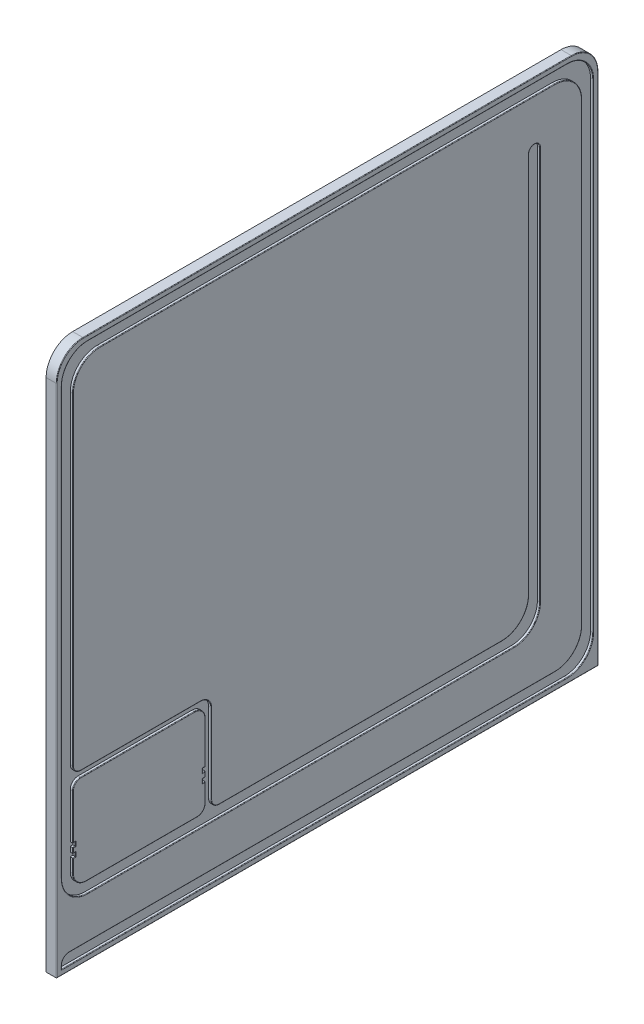
from build123d import *

# Parameters (mm, degrees)
BOSS_EXTRUDE1_DEPTH = 4
CUT_EXTRUDE3_DEPTH  = 1
FILLET1_R           = 0.2


with BuildPart() as part:
    # Sketch1 → Boss-Extrude1 (new body)
    with BuildSketch(Plane(origin=(0, 0, 0), x_dir=(0, 0, -1), z_dir=(1, 0, 0))):
        with BuildLine():
            Line((-102, -102), (102, -102))
            Line((102, -102), (102, 92))
            ThreePointArc((102, 92), (99.071067812, 99.071067812), (92, 102))
            Line((92, 102), (-92, 102))
            ThreePointArc((-92, 102), (-99.071067812, 99.071067812), (-102, 92))
            Line((-102, 92), (-102, -102))
        make_face()
    extrude(amount=BOSS_EXTRUDE1_DEPTH)

    # Sketch2 → Cut-Extrude3 (cut)
    with BuildSketch(Plane(origin=(4, 0, 0), x_dir=(0, 0, -1), z_dir=(1, 0, 0))):
        with BuildLine():
            Line((-100.1, 90.3), (-100.1, -70.3))
            ThreePointArc((-100.1, -70.3), (-97.229646456, -77.229646456), (-90.3, -80.1))
            Line((-90.3, -80.1), (70.3, -80.1))
            ThreePointArc((70.3, -80.1), (77.229646456, -77.229646456), (80.1, -70.3))
            Line((80.1, -70.3), (80.1, 78))
            ThreePointArc((80.1, 78), (78, 80.1), (75.9, 78))
            Line((75.9, 78), (75.9, -65.7))
            ThreePointArc((75.9, -65.7), (72.912489168, -72.912489168), (65.7, -75.9))
            Line((65.7, -75.9), (-40.8, -75.9))
            ThreePointArc((-40.8, -75.9), (-42.921320344, -75.021320344), (-43.8, -72.9))
            Line((-43.8, -72.9), (-43.8, -42.8))
            ThreePointArc((-43.8, -42.8), (-44.971572875, -39.971572875), (-47.8, -38.8))
            Line((-47.8, -38.8), (-92.9, -38.8))
            ThreePointArc((-92.9, -38.8), (-95.021320344, -37.921320344), (-95.9, -35.8))
            Line((-95.9, -35.8), (-95.9, 85.7))
            ThreePointArc((-95.9, 85.7), (-92.912489168, 92.912489168), (-85.7, 95.9))
            Line((-85.7, 95.9), (85.7, 95.9))
            ThreePointArc((85.7, 95.9), (92.912489168, 92.912489168), (95.9, 85.7))
            Line((95.9, 85.7), (95.9, -85.7))
            ThreePointArc((95.9, -85.7), (92.912489168, -92.912489168), (85.7, -95.9))
            Line((85.7, -95.9), (-97.3, -95.9))
            ThreePointArc((-97.3, -95.9), (-99.279898987, -96.720101013), (-100.1, -98.7))
            Line((-100.1, -98.7), (-100.1, -100.1))
            Line((-100.1, -100.1), (90.3, -100.1))
            ThreePointArc((90.3, -100.1), (97.229646456, -97.229646456), (100.1, -90.3))
            Line((100.1, -90.3), (100.1, 90.3))
            ThreePointArc((100.1, 90.3), (97.229646456, 97.229646456), (90.3, 100.1))
            Line((90.3, 100.1), (-90.3, 100.1))
            ThreePointArc((-90.3, 100.1), (-97.229646456, 97.229646456), (-100.1, 90.3))
        make_face()
        with BuildLine():
            Line((-90.9, -75.9), (-49, -75.9))
            ThreePointArc((-49, -75.9), (-46.878679656, -75.021320344), (-46, -72.9))
            Line((-46, -72.9), (-46, -65.9))
            Line((-46, -65.9), (-47, -65.9))
            Line((-47, -65.9), (-47, -64.4))
            Line((-47, -64.4), (-46, -64.4))
            Line((-46, -64.4), (-46, -62.5))
            Line((-46, -62.5), (-47, -62.5))
            Line((-47, -62.5), (-47, -61))
            Line((-47, -61), (-46, -61))
            Line((-46, -61), (-46, -45))
            ThreePointArc((-46, -45), (-47.171572875, -42.171572875), (-50, -41))
            Line((-50, -41), (-92.9, -41))
            ThreePointArc((-92.9, -41), (-95.021320344, -41.878679656), (-95.9, -44))
            Line((-95.9, -44), (-95.9, -61))
            Line((-95.9, -61), (-94.9, -61))
            Line((-94.9, -61), (-94.9, -62.5))
            Line((-94.9, -62.5), (-95.9, -62.5))
            Line((-95.9, -62.5), (-95.9, -64.4))
            Line((-95.9, -64.4), (-94.9, -64.4))
            Line((-94.9, -64.4), (-94.9, -65.9))
            Line((-94.9, -65.9), (-95.9, -65.9))
            Line((-95.9, -65.9), (-95.9, -70.9))
            ThreePointArc((-95.9, -70.9), (-94.435533906, -74.435533906), (-90.9, -75.9))
        make_face(mode=Mode.SUBTRACT)
    extrude(amount=-CUT_EXTRUDE3_DEPTH, mode=Mode.SUBTRACT)

    # Fillet1
    fillet1_edges = [part.edges().sort_by_distance(p)[0] for p in [
        (4, -102, 0),
        (4, -5, 102),
        (4, 99.071067812, 99.071067812),
        (4, 102, 0),
        (4, 99.071067812, -99.071067812),
        (4, -5, -102),
        (4, -72.912489168, -72.912489168),
        (4, -75.9, -12.45),
        (4, -75.021320344, 42.921320344),
        (4, -57.85, 43.8),
        (4, -39.971572875, 44.971572875),
        (4, -38.8, 70.35),
        (4, -37.921320344, 95.021320344),
        (4, 24.95, 95.9),
        (4, 92.912489168, 92.912489168),
        (4, 95.9, 0),
        (4, 92.912489168, -92.912489168),
        (4, 0, -95.9),
        (4, -92.912489168, -92.912489168),
        (4, -95.9, 5.8),
        (4, -96.720101013, 99.279898987),
        (4, -99.4, 100.1),
        (4, -100.1, 4.9),
        (4, -97.229646456, -97.229646456),
        (4, 0, -100.1),
        (4, 97.229646456, -97.229646456),
        (4, 100.1, 0),
        (4, 97.229646456, 97.229646456),
        (4, 10, 100.1),
        (4, -77.229646456, 97.229646456),
        (4, -80.1, 10),
        (4, -77.229646456, -77.229646456),
        (4, 3.85, -80.1),
        (4, 80.1, -78),
        (4, 6.15, -75.9),
        (4, -68.4, 95.9),
        (4, -65.9, 95.4),
        (4, -65.15, 94.9),
        (4, -64.4, 95.4),
        (4, -63.45, 95.9),
        (4, -62.5, 95.4),
        (4, -61.75, 94.9),
        (4, -61, 95.4),
        (4, -52.5, 95.9),
        (4, -41.878679656, 95.021320344),
        (4, -41, 71.45),
        (4, -42.171572875, 47.171572875),
        (4, -53, 46),
        (4, -61, 46.5),
        (4, -61.75, 47),
        (4, -62.5, 46.5),
        (4, -63.45, 46),
        (4, -64.4, 46.5),
        (4, -65.15, 47),
        (4, -65.9, 46.5),
        (4, -69.4, 46),
        (4, -75.021320344, 46.878679656),
        (4, -75.9, 69.95),
        (4, -74.435533906, 94.435533906),
    ]]
    fillet(fillet1_edges, radius=FILLET1_R)


solid = part.part
